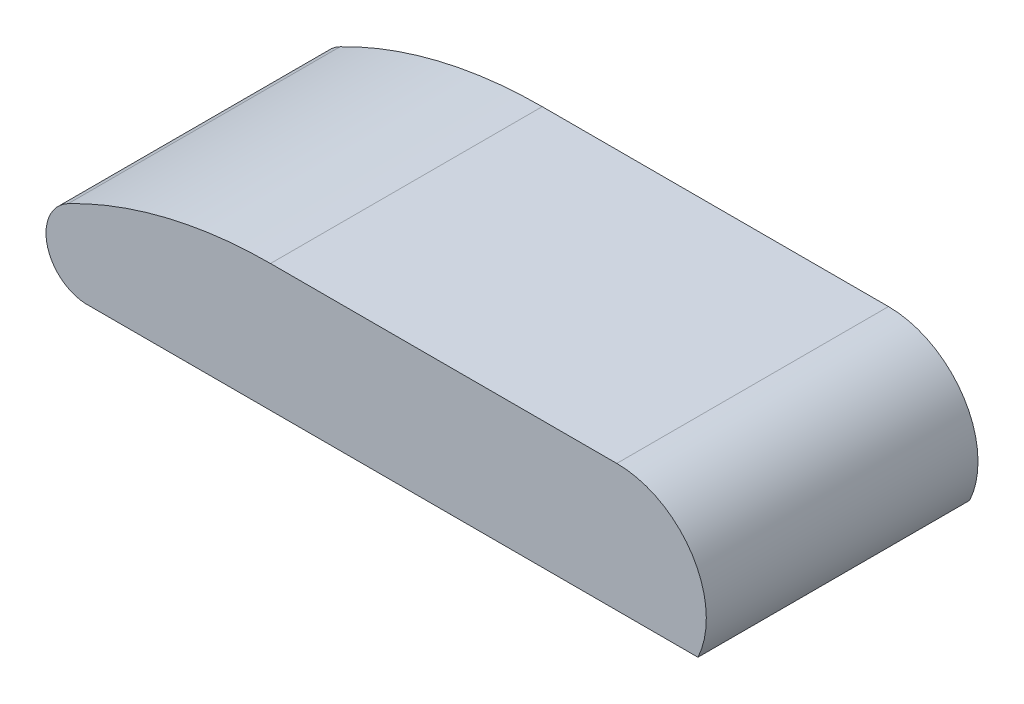
from build123d import *

# Parameters (mm, degrees)
BOSS_EXTRUDE1_DEPTH = 38
BOSS_EXTRUDE2_START = 1
BOSS_EXTRUDE2_DEPTH = 1
SKETCH3_W           = 90.179925192
SKETCH3_H           = 40
SKETCH3_W_2         = 69.416494059
SKETCH3_H_2         = 32
BOSS_EXTRUDE3_DEPTH = 1
CHAMFER1_SIZE       = 1


with BuildPart() as part:
    # Sketch1 → Boss-Extrude1 (new body)
    with BuildSketch(Plane.XY):
        with BuildLine():
            Line((66.52, 14.5), (15.54, 14.5))
            ThreePointArc((15.54, 14.5), (0.223169493, 12.66316181), (-14.225037528, 7.256815055))
            ThreePointArc((-14.225037528, 7.256815055), (-17.376400179, 0.546177113), (-11.711514098, -4.236375954))
            Line((-11.711514098, -4.236375954), (-6.590403043, -4.236765961))
            Line((-6.590403043, -4.236765961), (-6.590326886, -3.236765964))
            Line((-6.590326886, -3.236765964), (-11.687025279, -3.236377816))
            ThreePointArc((-11.687025279, -3.236377816), (-16.401861513, 0.77072863), (-13.765555848, 6.368627808))
            ThreePointArc((-13.765555848, 6.368627808), (0.459614785, 11.691517006), (15.54, 13.5))
            Line((15.54, 13.5), (66.52, 13.5))
            ThreePointArc((66.52, 13.5), (76.617843982, 8.130760845), (77.812974461, -3.243193847))
            Line((77.812974461, -3.243193847), (72.705055873, -3.242804844))
            Line((72.705055873, -3.242804844), (72.704979716, -4.242804841))
            Line((72.704979716, -4.242804841), (78.468410832, -4.243243765))
            ThreePointArc((78.468410832, -4.243243765), (77.633884428, 8.404811863), (66.52, 14.5))
        make_face()
    extrude(amount=BOSS_EXTRUDE1_DEPTH)

    # Sketch2 → Boss-Extrude2 (add)
    with BuildSketch(Plane(origin=(0, 0, 0), x_dir=(-1, 0, 0), z_dir=(0, 0, -1)).offset(BOSS_EXTRUDE2_START)):
        with BuildLine():
            Line((-72.704979716, -4.242804841), (6.590403043, -4.236765961))
            Line((6.590403043, -4.236765961), (11.711514098, -4.236375954))
            ThreePointArc((11.711514098, -4.236375954), (17.376400179, 0.546177113), (14.225037528, 7.256815055))
            ThreePointArc((14.225037528, 7.256815055), (-0.223169493, 12.66316181), (-15.54, 14.5))
            Line((-15.54, 14.5), (-66.52, 14.5))
            ThreePointArc((-66.52, 14.5), (-77.633884428, 8.404811863), (-78.468410832, -4.243243765))
            Line((-78.468410832, -4.243243765), (-72.704979716, -4.242804841))
        make_face()
    boss_extrude2 = extrude(amount=-BOSS_EXTRUDE2_DEPTH)

    # Mirror1: Boss-Extrude2 across plane
    add(boss_extrude2.mirror(Plane.XY.offset(19)))

    # Sketch3 → Boss-Extrude3 (add)
    with BuildSketch(Plane(origin=(-0.000322697, -4.23726784, 0), x_dir=(0.9999999971000731, -7.615677136513779e-05, 0), z_dir=(-7.615677136513779e-05, -0.9999999971000731, 0))):
        with Locations((33.378771161, 19)):
            Rectangle(SKETCH3_W, SKETCH3_H)
        with Locations((29.997055594, 19)):
            Rectangle(SKETCH3_W_2, SKETCH3_H_2, mode=Mode.SUBTRACT)
    extrude(amount=BOSS_EXTRUDE3_DEPTH)

    # Chamfer1
    chamfer1_edges = [part.edges().sort_by_distance(p)[0] for p in [
        (-11.711590255, -5.236375951, 19),
        (-4.711590275, -5.236909048, 19),
        (29.996656654, -5.239552316, 3),
        (29.996656654, -5.239552316, 35),
        (64.704903583, -5.242195584, 19),
        (78.468334676, -5.243243763, 19),
        (33.37837221, -5.239809857, 39),
        (33.37837221, -5.239809857, -1),
    ]]
    chamfer(chamfer1_edges, length=CHAMFER1_SIZE - 0.0001)  # a hair under: the kernel refuses the full size


solid = part.part
